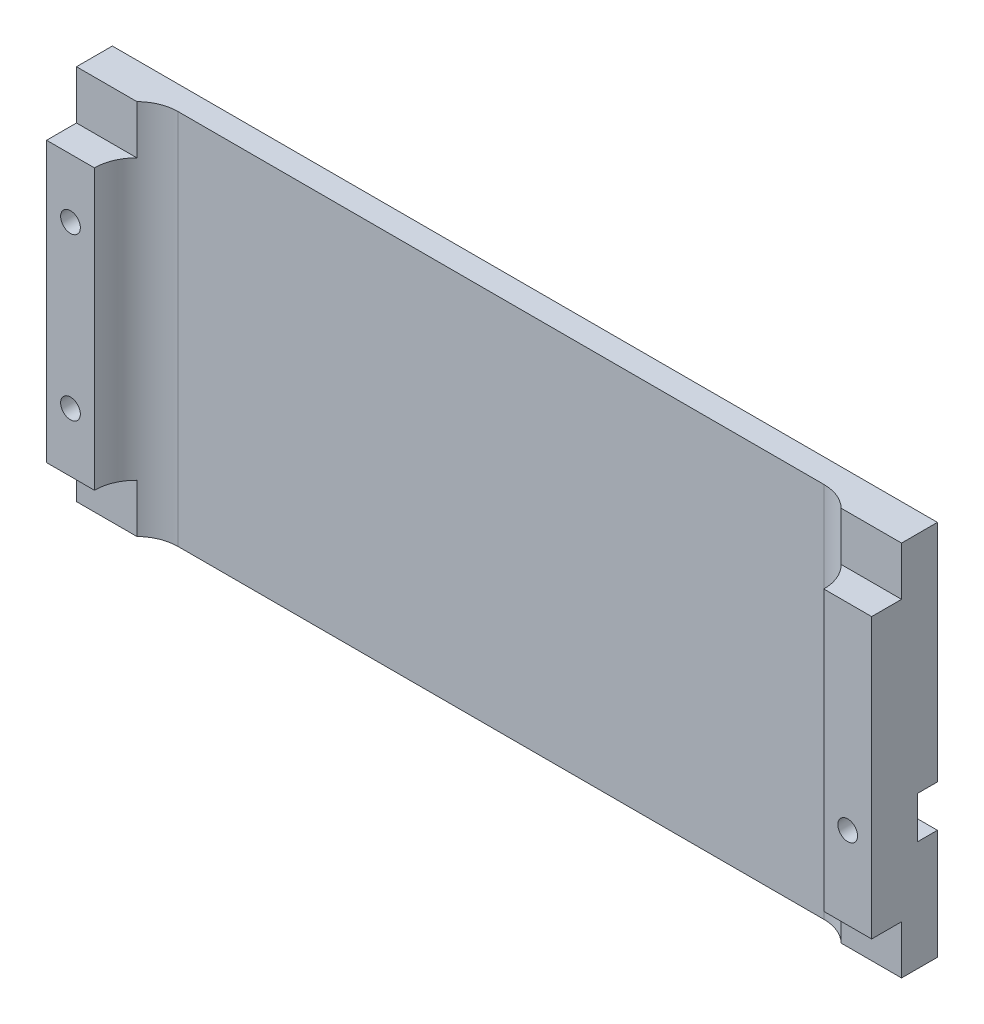
from build123d import *

# Parameters (mm, degrees)
ESBO_O1_W                = 138
ESBO_O1_H                = 63
RESSALTO_EXTRUS_O1_DEPTH = 4
ESBO_O2_W                = 8
ESBO_O2_H                = 63
RESSALTO_EXTRUS_O2_DEPTH = 2
ESBO_O3_W                = 8
ESBO_O3_H                = 46.7
RESSALTO_EXTRUS_O3_DEPTH = 5
ESBO_O4_R                = 1.65
CORTE_EXTRUS_O1_DEPTH    = 77.643655967
CORTE_EXTRUS_O2_DEPTH    = 3.3
FILETE1_R                = 7


with BuildPart() as part:
    # Esboço1 → Ressalto-extrusão1 (new body)
    with BuildSketch(Plane.XY):
        Rectangle(ESBO_O1_W, ESBO_O1_H)
    extrude(amount=RESSALTO_EXTRUS_O1_DEPTH)

    # Esboço2 → Ressalto-extrusão2 (add)
    with BuildSketch(Plane.XY.offset(4)):
        with Locations((65, 0)):
            Rectangle(ESBO_O2_W, ESBO_O2_H)
        with Locations((-65, 0)):
            Rectangle(ESBO_O2_W, ESBO_O2_H)
    extrude(amount=RESSALTO_EXTRUS_O2_DEPTH)

    # Esboço3 → Ressalto-extrusão3 (add)
    with BuildSketch(Plane.XY.offset(6)):
        with Locations((65, 0)):
            Rectangle(ESBO_O3_W, ESBO_O3_H)
        with Locations((-65, 0)):
            Rectangle(ESBO_O3_W, ESBO_O3_H)
    extrude(amount=RESSALTO_EXTRUS_O3_DEPTH)

    # Esboço4 → Corte-extrusão1 (cut, through all)
    with BuildSketch(Plane(origin=(0, 0, 0), x_dir=(-1, 0, 0), z_dir=(0, 0, -1))):
        with Locations((65, -13.5)):
            Circle(ESBO_O4_R)
        with Locations((65, 13.5)):
            Circle(ESBO_O4_R)
        with Locations((-65, -9.6)):
            Circle(ESBO_O4_R)
    extrude(amount=-CORTE_EXTRUS_O1_DEPTH, mode=Mode.SUBTRACT)

    # Esboço5 → Corte-extrusão2 (cut)
    with BuildSketch(Plane(origin=(0, 0, 0), x_dir=(-1, 0, 0), z_dir=(0, 0, -1))):
        with BuildLine():
            Line((65, -17), (69, -17))
            Line((69, -17), (69, -10))
            Line((69, -10), (65, -10))
            ThreePointArc((65, -10), (61.5, -13.5), (65, -17))
        make_face()
        with BuildLine():
            Line((65, 10), (69, 10))
            Line((69, 10), (69.148700963, 17))
            Line((69.148700963, 17), (65, 17))
            ThreePointArc((65, 17), (61.5, 13.5), (65, 10))
        make_face()
        with BuildLine():
            Line((-65, -6.1), (-69, -6.1))
            Line((-69, -6.1), (-69, -13.1))
            Line((-69, -13.1), (-65, -13.1))
            ThreePointArc((-65, -13.1), (-61.5, -9.6), (-65, -6.1))
        make_face()
    extrude(amount=-CORTE_EXTRUS_O2_DEPTH, mode=Mode.SUBTRACT)

    # Filete1
    filete1_edges = [part.edges().sort_by_distance(p)[0] for p in [
        (61, 0, 4),
        (-61, 0, 4),
    ]]
    fillet(filete1_edges, radius=FILETE1_R - 0.0001)  # a hair under: the kernel refuses the full size


solid = part.part
